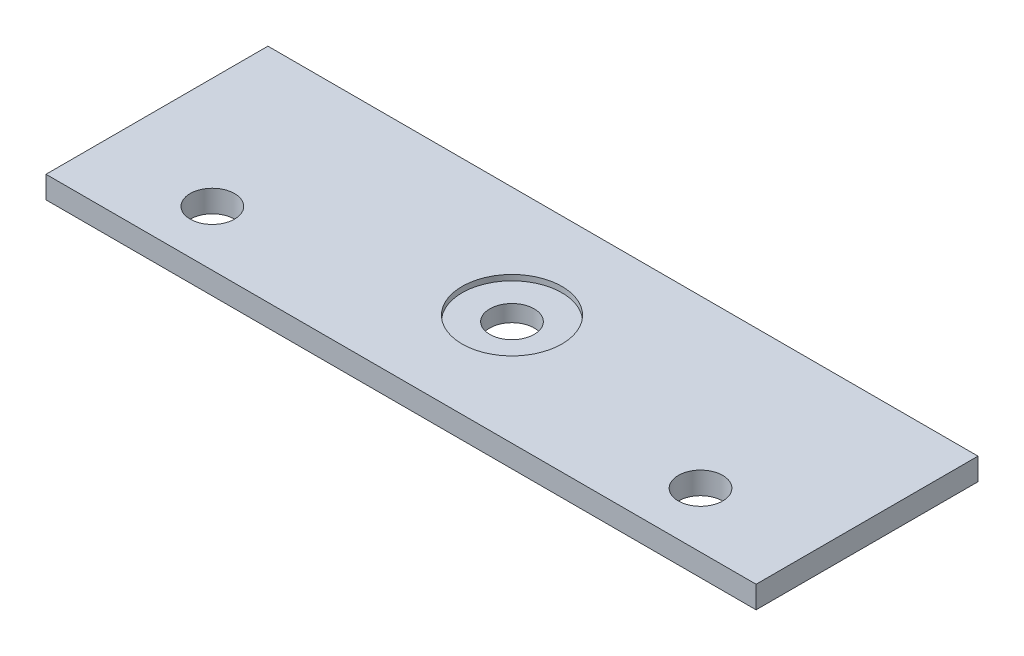
from build123d import *

# Parameters (mm, degrees)
SKETCH8_W           = 203.2
SKETCH8_H           = 63.5
BOSS_EXTRUDE1_DEPTH = 6.35
SKETCH9_R           = 14.2875
CUT_EXTRUDE2_DEPTH  = 1.5875
SKETCH10_R          = 6.35
CUT_EXTRUDE3_DEPTH  = 213.944056987
SKETCH11_R          = 6.35
CUT_EXTRUDE4_DEPTH  = 213.985474857


with BuildPart() as part:
    # Sketch8 → Boss-Extrude1 (new body)
    with BuildSketch(Plane(origin=(0, 0, 0), x_dir=(1, 0, 0), z_dir=(0, 1, 0))):
        with Locations((-101.6, 31.75)):
            Rectangle(SKETCH8_W, SKETCH8_H)
    extrude(amount=BOSS_EXTRUDE1_DEPTH)

    # Sketch9 → Cut-Extrude2 (cut)
    with BuildSketch(Plane(origin=(0, 6.35, 0), x_dir=(1, 0, 0), z_dir=(0, 1, 0))):
        with Locations((-101.6, 31.75)):
            Circle(SKETCH9_R)
    extrude(amount=-CUT_EXTRUDE2_DEPTH, mode=Mode.SUBTRACT)

    # Sketch10 → Cut-Extrude3 (cut, through all)
    with BuildSketch(Plane(origin=(0, 4.7625, 0), x_dir=(1, 0, 0), z_dir=(0, 1, 0))):
        with Locations((-101.6, 31.75)):
            Circle(SKETCH10_R)
    extrude(amount=-CUT_EXTRUDE3_DEPTH, mode=Mode.SUBTRACT)

    # Sketch11 → Cut-Extrude4 (cut, through all)
    with BuildSketch(Plane(origin=(0, 6.35, 0), x_dir=(1, 0, 0), z_dir=(0, 1, 0))):
        with Locations((-171.45, 15.85)):
            Circle(SKETCH11_R)
        with Locations((-31.75, 15.85)):
            Circle(SKETCH11_R)
    extrude(amount=-CUT_EXTRUDE4_DEPTH, mode=Mode.SUBTRACT)


solid = part.part
